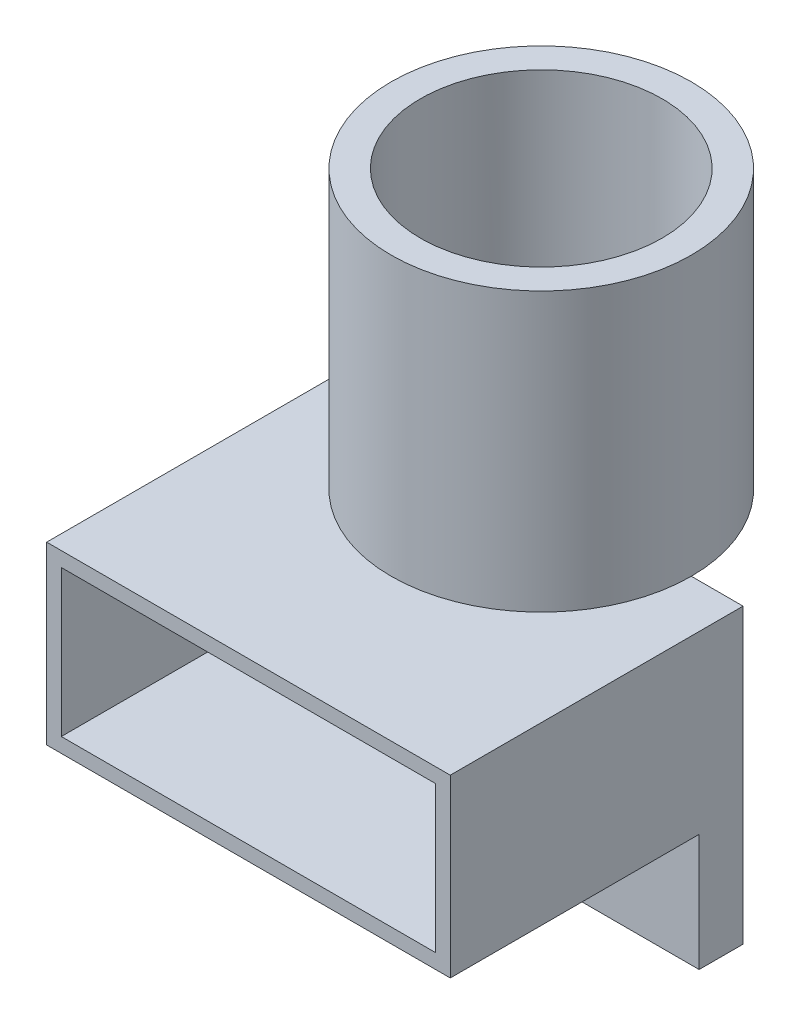
from build123d import *

# Parameters (mm, degrees)
SKETCH_2_R          = 10.255
SKETCH_2_R_2        = 8.255
F_19MM_DEPTH        = 19
EXTRUDE_START       = -11
EXTRUDE_3_DEPTH     = 11
SKETCH_646_W        = 27.57
SKETCH_646_H        = 12
EXTRUDE_698_DEPTH   = 20
SKETCH_6_W          = 25.57
SKETCH_6_H          = 10
CUT_EXTRUDE_1_DEPTH = 15
FILLET_1_R          = 5
SKETCH_10_W         = 27.57
SKETCH_10_H         = 3
EXTRUDE_3_2_DEPTH   = 8


with BuildPart() as part:
    # 草圖2 → 19mm (new body)
    with BuildSketch(Plane(origin=(0, 0, 0), x_dir=(1, 0, 0), z_dir=(0, 1, 0))):
        Circle(SKETCH_2_R)
        Circle(SKETCH_2_R_2, mode=Mode.SUBTRACT)
    extrude(amount=F_19MM_DEPTH)

    # 草圖13 → Extrude 3 (add)
    with BuildSketch(Plane(origin=(0, 0, 0), x_dir=(1, 0, 0), z_dir=(0, 1, 0)).offset(EXTRUDE_START)):
        with BuildLine():
            ThreePointArc((-8.255, 0), (0, -8.255), (8.255, 0))
            Line((8.255, 0), (10.255, 0))
            ThreePointArc((10.255, 0), (0, -10.255), (-10.255, 0))
            Line((-10.255, 0), (-8.255, 0))
        make_face()
    extrude(amount=EXTRUDE_3_DEPTH)

    # Sketch 646 → Extrude 698 (add)
    with BuildSketch(Plane.XY):
        with Locations((0, -6)):
            Rectangle(SKETCH_646_W, SKETCH_646_H)
    extrude(amount=EXTRUDE_698_DEPTH)

    # 草圖6 → 除料-伸長1 (cut)
    with BuildSketch(Plane.XY.offset(20)):
        with Locations((0, -6)):
            Rectangle(SKETCH_6_W, SKETCH_6_H)
    extrude(amount=-CUT_EXTRUDE_1_DEPTH, mode=Mode.SUBTRACT)

    # 圓角1
    # the kernel refuses this fillet: 5 mm, written as the material it takes off along each edge
    with BuildSketch(Plane(origin=(-20.755, 0, 0), x_dir=(0, -1, 0), z_dir=(1, 0, 0))) as fillet_1_piece_1_section:
        with BuildLine():
            CenterArc((FILLET_1_R, -FILLET_1_R), FILLET_1_R, 90, 90)
            Line((0, -FILLET_1_R), (0, 0))
            Line((0, 0), (FILLET_1_R, 0))
        make_face()
    fillet_1_piece_1 = extrude(amount=41.51, mode=Mode.PRIVATE)
    fillet_1_piece_1 = fillet_1_piece_1 & Plane(origin=(0, -1.128045065, 0), x_dir=(1, 0, 0), z_dir=(0, -1, 0)) * Cylinder(8.255, 104, mode=Mode.PRIVATE)
    add(fillet_1_piece_1, mode=Mode.SUBTRACT)

    # 草圖10 → Extrude 3 2 (add)
    with BuildSketch(Plane.XZ.offset(12)):
        with Locations((0, 1.5)):
            Rectangle(SKETCH_10_W, SKETCH_10_H)
    extrude(amount=EXTRUDE_3_2_DEPTH)


solid = part.part
